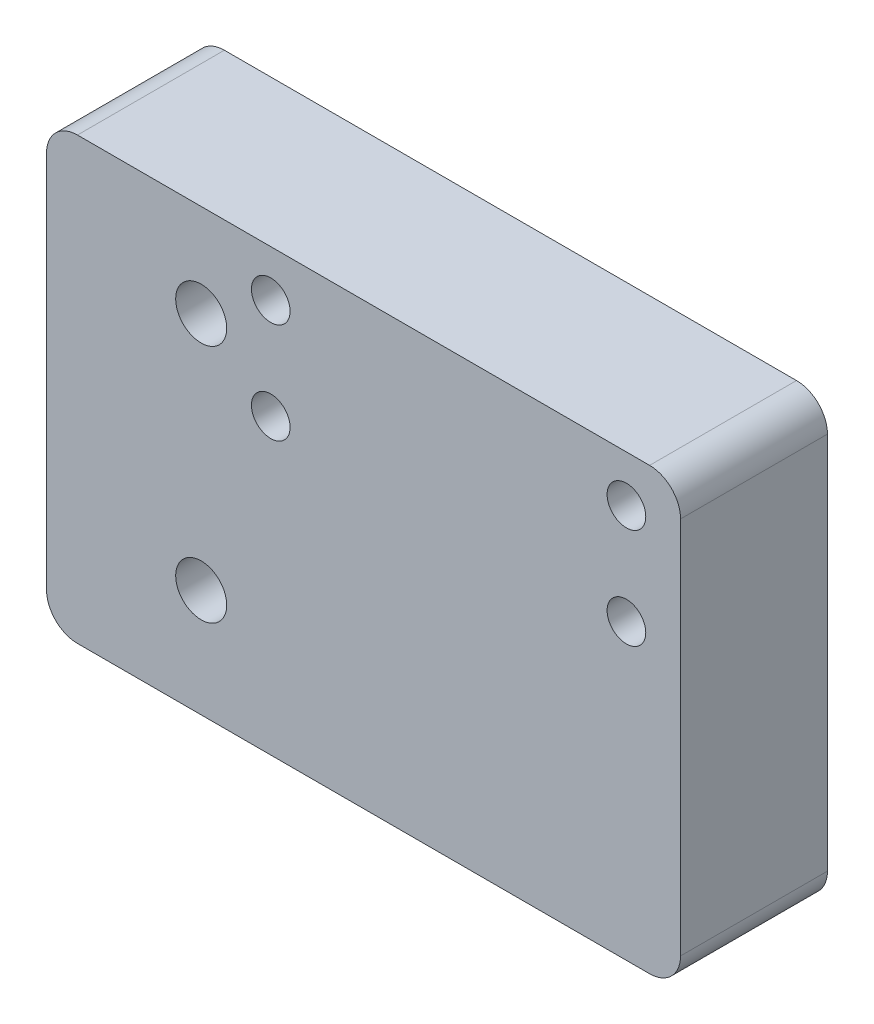
from build123d import *

# Parameters (mm, degrees)
SKETCH1_W                                           = 81.999999998
SKETCH1_H                                           = 60
BOSS_EXTRUDE1_DEPTH                                 = 19
TAP_DRILL_FOR_M6_TAP1_D                             = 5
CSK_FOR_M6_COUNTERSUNK_FLAT_HEAD_SCREW1_D           = 6.6
CSK_FOR_M6_COUNTERSUNK_FLAT_HEAD_SCREW1_CSINK_D     = 12.6
CSK_FOR_M6_COUNTERSUNK_FLAT_HEAD_SCREW1_CSINK_ANGLE = 90
SKETCH7_W                                           = 81.999999998
SKETCH7_H                                           = 4
CUT_EXTRUDE1_DEPTH                                  = 95.50348792
SKETCH10_W                                          = 81.999999998
SKETCH10_H                                          = 0.95
BOSS_EXTRUDE2_DEPTH                                 = 19
FILLET1_R                                           = 4
TAP_DRILL_FOR_M5_TAP1_D                             = 4.2
TAP_DRILL_FOR_M5_TAP1_DEPTH                         = 30
TAP_DRILL_FOR_M5_TAP1_TIP                           = 1.2618073


with BuildPart() as part:
    # Sketch1 → Boss-Extrude1 (new body)
    with BuildSketch(Plane.XY):
        with Locations((20.999999999, 38.745248777)):
            Rectangle(SKETCH1_W, SKETCH1_H)
    extrude(amount=BOSS_EXTRUDE1_DEPTH)

    # Tap Drill for M6 Tap1 (through all)
    with Locations(Plane.XY.offset(19)):
        with Locations((8.999999998, 58.745248777), (54.999999998, 58.745248777), (54.999999998, 45.745248777), (8.999999998, 45.745248777)):
            Hole(TAP_DRILL_FOR_M6_TAP1_D / 2)

    # CSK for M6 Countersunk Flat Head Screw1 (through all)
    with Locations(Plane(origin=(0, 0, 0), x_dir=(1, 0, 0), z_dir=(0, 0, -1))):
        with Locations((0, -21.745248777), (0, -52.745248777)):
            CounterSinkHole(CSK_FOR_M6_COUNTERSUNK_FLAT_HEAD_SCREW1_D / 2, CSK_FOR_M6_COUNTERSUNK_FLAT_HEAD_SCREW1_CSINK_D / 2, counter_sink_angle=CSK_FOR_M6_COUNTERSUNK_FLAT_HEAD_SCREW1_CSINK_ANGLE)

    # Sketch7 → Cut-Extrude1 (cut, through all)
    with BuildSketch(Plane(origin=(0, 0, 0), x_dir=(-1, 0, 0), z_dir=(0, 0, -1))):
        with Locations((-20.999999999, 66.745248777)):
            Rectangle(SKETCH7_W, SKETCH7_H)
    extrude(amount=-CUT_EXTRUDE1_DEPTH, mode=Mode.SUBTRACT)

    # Sketch10 → Boss-Extrude2 (add)
    with BuildSketch(Plane(origin=(0, 0, 0), x_dir=(-1, 0, 0), z_dir=(0, 0, -1))):
        with Locations((-20.999999999, 8.270248777)):
            Rectangle(SKETCH10_W, SKETCH10_H)
    extrude(amount=-BOSS_EXTRUDE2_DEPTH)

    # Fillet1
    fillet1_edges = [part.edges().sort_by_distance(p)[0] for p in [
        (-20, 7.795248777, 9.5),
        (61.999999998, 7.795248777, 9.5),
        (-20, 64.745248777, 9.5),
        (61.999999998, 64.745248777, 9.5),
    ]]
    fillet(fillet1_edges, radius=FILLET1_R)

    # Tap Drill for M5 Tap1
    with Locations(Plane(origin=(0, 7.795248777, 0), x_dir=(-1, 0, 0), z_dir=(0, -1, 0))):
        with Locations((-41.999999998, -9.499999998)):
            Hole(TAP_DRILL_FOR_M5_TAP1_D / 2, depth=TAP_DRILL_FOR_M5_TAP1_DEPTH)
            with Locations((0, 0, -(TAP_DRILL_FOR_M5_TAP1_DEPTH + TAP_DRILL_FOR_M5_TAP1_TIP / 2))):  # 118° drill point
                Cone(0, TAP_DRILL_FOR_M5_TAP1_D / 2, TAP_DRILL_FOR_M5_TAP1_TIP, mode=Mode.SUBTRACT)


solid = part.part
